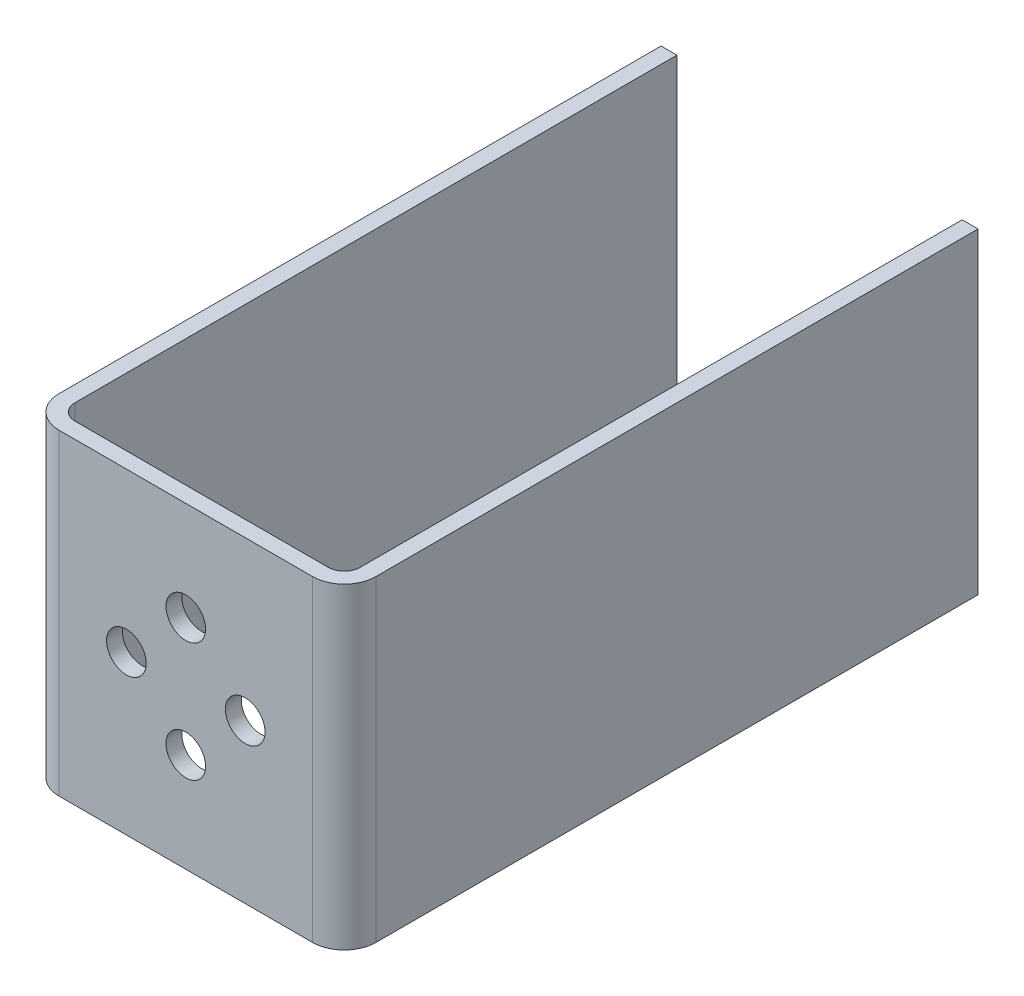
from build123d import *

# Parameters (mm, degrees)
BOSS_EXTRUDE1_DEPTH = 50.8
SKETCH2_R           = 3.175
CUT_EXTRUDE2_DEPTH  = 123.36896502


with BuildPart() as part:
    # Sketch1 → Boss-Extrude1 (new body)
    with BuildSketch(Plane(origin=(0, 0, 0), x_dir=(1, 0, 0), z_dir=(0, 1, 0))):
        with BuildLine():
            Line((0, 101.6), (2.54, 101.6))
            Line((2.54, 101.6), (2.54, 5.08))
            ThreePointArc((2.54, 5.08), (3.283948776, 3.283948776), (5.08, 2.54))
            Line((5.08, 2.54), (45.72, 2.54))
            ThreePointArc((45.72, 2.54), (47.516051224, 3.283948776), (48.26, 5.08))
            Line((48.26, 5.08), (48.26, 101.6))
            Line((48.26, 101.6), (50.8, 101.6))
            Line((50.8, 101.6), (50.8, 5.08))
            ThreePointArc((50.8, 5.08), (49.312102448, 1.487897552), (45.72, 0))
            Line((45.72, 0), (5.08, 0))
            ThreePointArc((5.08, 0), (1.487897552, 1.487897552), (0, 5.08))
            Line((0, 5.08), (0, 101.6))
        make_face()
    extrude(amount=BOSS_EXTRUDE1_DEPTH)

    # Sketch2 → Cut-Extrude2 (cut, through all)
    with BuildSketch(Plane(origin=(0, 0, -2.54), x_dir=(-1, 0, 0), z_dir=(0, 0, -1))):
        with Locations((-34.925, 25.4)):
            Circle(SKETCH2_R)
        with Locations((-25.4, 34.925)):
            Circle(SKETCH2_R)
        with Locations((-15.875, 25.4)):
            Circle(SKETCH2_R)
        with Locations((-25.4, 15.875)):
            Circle(SKETCH2_R)
    extrude(amount=-CUT_EXTRUDE2_DEPTH, mode=Mode.SUBTRACT)


solid = part.part
